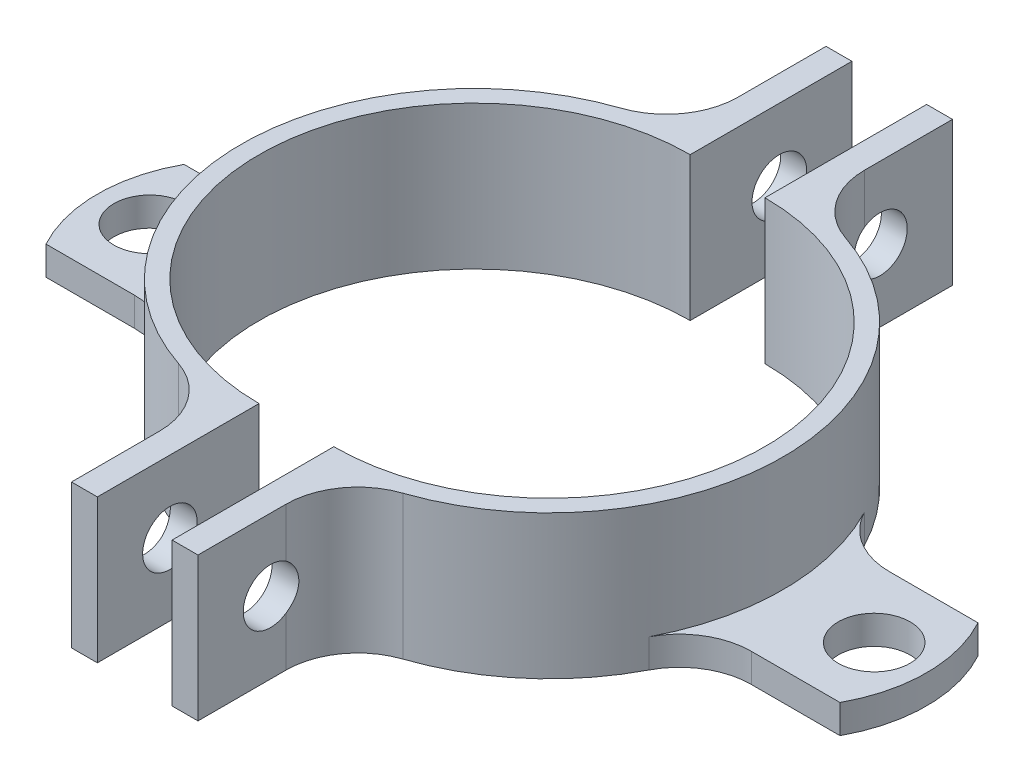
from build123d import *

# Parameters (mm, degrees)
BOSS_EXTRUDE1_DEPTH = 12.7
SKETCH1_4_R         = 3.175
BOSS_EXTRUDE2_DEPTH = 2.54
SKETCH4_R           = 2.413
CUT_EXTRUDE1_DEPTH  = 2.286
SKETCH4_3_R         = 2.413
CUT_EXTRUDE2_DEPTH  = 2.54
FILLET1_R           = 6.35


with BuildPart() as part:
    # Sketch1 → Boss-Extrude1 (new body)
    with BuildSketch(Plane(origin=(0, 0, 0), x_dir=(1, 0, 0), z_dir=(0, 1, 0))):
        with BuildLine():
            Line((0, 33.3375), (0, 20.6375))
            ThreePointArc((0, 20.6375), (1.14476253, 20.605725539), (2.286, 20.5105))
            Line((2.286, 20.5105), (2.286, 33.3375))
            Line((2.286, 33.3375), (0, 33.3375))
        make_face()
        with BuildLine():
            Line((0, 20.6375), (0, 19.05))
            ThreePointArc((0, 19.05), (19.05, 0), (0, -19.05))
            Line((0, -19.05), (0, -20.6375))
            ThreePointArc((0, -20.6375), (1.14476253, -20.605725539), (2.286, -20.5105))
            ThreePointArc((2.286, -20.5105), (13.150947863, -15.904684107), (19.715868102, -6.098438425))
            ThreePointArc((19.715868102, -6.098438425), (20.6375, 0), (19.715868102, 6.098438425))
            ThreePointArc((19.715868102, 6.098438425), (13.150947863, 15.904684107), (2.286, 20.5105))
            ThreePointArc((2.286, 20.5105), (1.14476253, 20.605725539), (0, 20.6375))
        make_face()
        with BuildLine():
            ThreePointArc((2.286, -20.5105), (1.14476253, -20.605725539), (0, -20.6375))
            Line((0, -20.6375), (0, -33.3375))
            Line((0, -33.3375), (2.286, -33.3375))
            Line((2.286, -33.3375), (2.286, -20.5105))
        make_face()
    extrude(amount=BOSS_EXTRUDE1_DEPTH)

    # Sketch1<4> → Boss-Extrude2 (add)
    with BuildSketch(Plane(origin=(0, 0, 0), x_dir=(1, 0, 0), z_dir=(0, 1, 0))):
        with BuildLine():
            Line((31.777475259, 6.098438425), (19.715868102, 6.098438425))
            ThreePointArc((19.715868102, 6.098438425), (20.6375, 0), (19.715868102, -6.098438425))
            Line((19.715868102, -6.098438425), (31.777475259, -6.098438425))
            ThreePointArc((31.777475259, -6.098438425), (33.3375, 0), (31.777475259, 6.098438425))
        make_face()
        with Locations(Location((28.702, 0, 0), (0, 0, 270))):
            Circle(SKETCH1_4_R, mode=Mode.SUBTRACT)
    extrude(amount=BOSS_EXTRUDE2_DEPTH)

    # Sketch4 → Cut-Extrude1 (cut)
    with BuildSketch(Plane(origin=(2.286, 0, 0), x_dir=(0, 0, -1), z_dir=(1, 0, 0))):
        with Locations((26.924, 6.35)):
            Circle(SKETCH4_R)
    extrude(amount=-CUT_EXTRUDE1_DEPTH, mode=Mode.SUBTRACT)

    # Sketch4<3> → Cut-Extrude2 (cut)
    with BuildSketch(Plane(origin=(2.286, 0, 0), x_dir=(0, 0, -1), z_dir=(1, 0, 0))):
        with Locations((26.924, 6.35)):
            Circle(SKETCH4_3_R)
        with Locations((-26.924, 6.35)):
            Circle(SKETCH4_3_R)
    extrude(amount=-CUT_EXTRUDE2_DEPTH, mode=Mode.SUBTRACT)

    # Fillet1
    # the kernel refuses this fillet: 6.35 mm, written as the material it adds along each edge
    with BuildSketch(Plane(origin=(2.286, 0, -20.5105), x_dir=(0, 0, -1), z_dir=(0, 1, 0))) as fillet1_piece_1_section:
        with BuildLine():
            CenterArc((5.057930931, -6.35), FILLET1_R, 90, 71.337075115)
            ThreePointArc((-0.958170465, -4.318), (-0.363071911, -2.184743524), (0, 0))
            Line((0, 0), (5.057930931, 0))
        make_face()
    fillet1_piece_1 = extrude(amount=12.7, mode=Mode.PRIVATE)
    fillet1_piece_1 = fillet1_piece_1 - Plane(origin=(3.246352343, 6.35, -26.924), x_dir=(0, 0, -1), z_dir=(1, 0, 0)) * Cylinder(2.413, 46, mode=Mode.PRIVATE)
    add(fillet1_piece_1)
    with BuildSketch(Plane(origin=(2.286, 0, 20.5105), x_dir=(0.9762533295562881, 0, -0.21663203025005656), z_dir=(0, 1, 0))) as fillet1_piece_2_section:
        with BuildLine():
            CenterArc((5.103498796, -6.313435304), FILLET1_R, 96.151632323, 71.337075115)
            Line((-1.095709846, -4.937821912), (0, 0))
            ThreePointArc((0, 0), (2.211516145, -0.118835263), (4.42303229, 0))
        make_face()
    fillet1_piece_2 = extrude(amount=12.7, mode=Mode.PRIVATE)
    fillet1_piece_2 = fillet1_piece_2 - Plane(origin=(3.246352283, 6.35, 26.924), x_dir=(0, 0, -1), z_dir=(1, 0, 0)) * Cylinder(2.413, 46, mode=Mode.PRIVATE)
    add(fillet1_piece_2)
    with BuildSketch(Plane(origin=(19.715868102, 0, 6.098438425), x_dir=(-0.3799128723665478, 0, 0.9250222750886592), z_dir=(0, 1, 0))) as fillet1_piece_3:
        with BuildLine():
            CenterArc((4.267201604, 6.324459208), FILLET1_R, 202.328285877, 62.531116376)
            Line((-1.606689843, 3.912012469), (0, 0))
            ThreePointArc((0, 0), (1.849120695, 0.083007574), (3.69824139, 0))
        make_face()
    extrude(amount=2.54)
    with BuildSketch(Plane(origin=(19.715868102, 0, -6.098438425), x_dir=(-0.37991287236654947, 0, -0.9250222750886584), z_dir=(0, 1, 0))) as fillet1_piece_4:
        with BuildLine():
            CenterArc((4.267201604, -6.324459208), FILLET1_R, 95.140597747, 62.531116376)
            Line((-1.606689843, -3.912012469), (0, 0))
            ThreePointArc((0, 0), (1.849120695, -0.083007574), (3.69824139, 0))
        make_face()
    extrude(amount=2.54)


with BuildPart() as body_2:
    # Mirror4: mirrored copy
    add(part.part.mirror(Plane(origin=(-3.302, 0, 0), x_dir=(0, 0, 1), z_dir=(1, 0, 0))))


solid = Compound([part.part, body_2.part])
